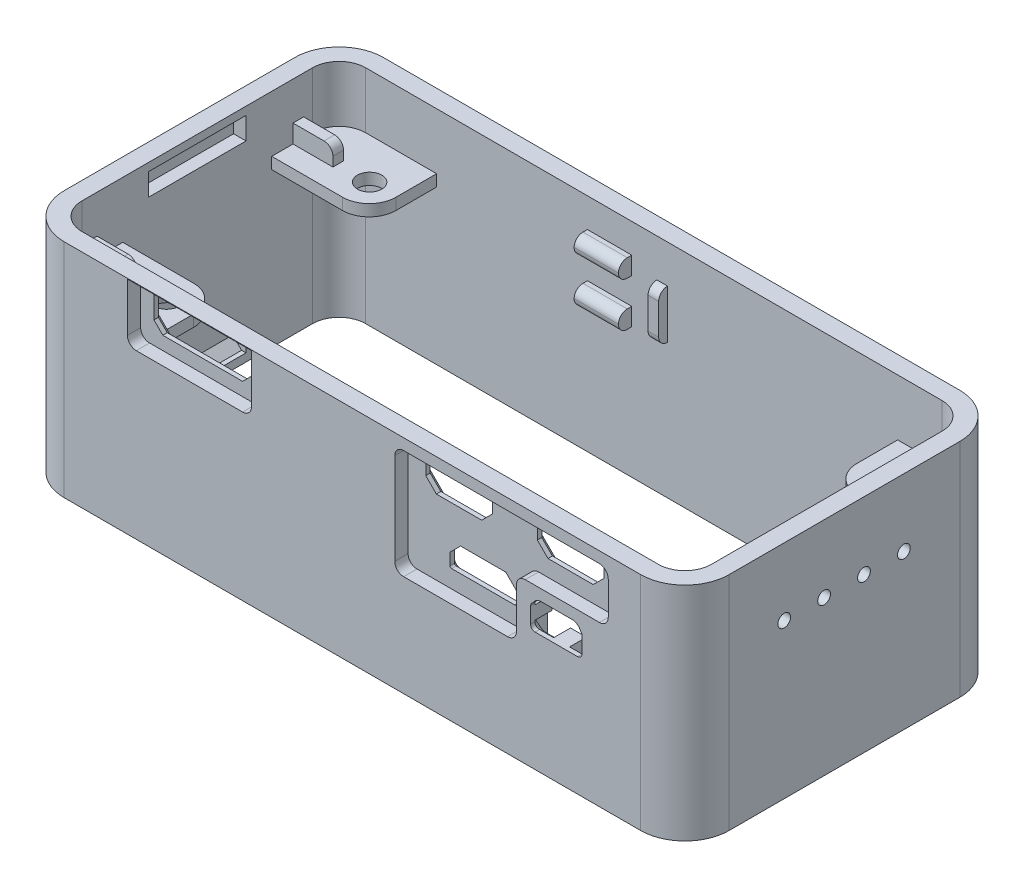
from build123d import *

# Parameters (mm, degrees)
EXTRUDE_1_DEPTH          = 7
EXTRUDE_1_DEPTH_BACK     = 18
CUT_EXTRUDE_2_DEPTH      = 47.607865253
CUT_EXTRUDE_2_DEPTH_BACK = 47.607865253
RIB_START                = -0.65
RIB_1_DEPTH              = 1.3
RIB_2_DEPTH              = 1.3
RIB_3_DEPTH              = 1.3
RIB_4_DEPTH              = 1.3
CUT_EXTRUDE_5_DEPTH      = 40
CUT_EXTRUDE_5_DEPTH_BACK = 40
SKETCH_18_R              = 1.375
SKETCH_41_W              = 14
SKETCH_41_H              = 6.5
CUT_EXTRUDE_14_DEPTH     = 1.5
EXTRUDE_14_DEPTH         = 0.5
CUT_EXTRUDE_18_DEPTH     = 1.5
SKETCH_50_W              = 7.5
SKETCH_50_H              = 2.7
CUT_EXTRUDE_19_DEPTH     = 2.9
SKETCH_51_W              = 5.8
SKETCH_51_H              = 2.8
CUT_EXTRUDE_20_DEPTH     = 2.4
FILLET_15_R              = 1
FILLET_16_R              = 1
FILLET_17_R              = 0.5
SKETCH_52_R              = 0.717792346
CUT_EXTRUDE_21_DEPTH     = 2
SKETCH_53_W              = 1.2
SKETCH_53_H              = 5.5
EXTRUDE_15_DEPTH         = 1
FILLET_20_R              = 1
SKETCH_55_W              = 1.2
SKETCH_55_H              = 5.5
EXTRUDE_17_DEPTH         = 1.4
SKETCH_54_W              = 1.2
SKETCH_54_H              = 5.5
EXTRUDE_18_DEPTH         = 4.5
FILLET_22_R              = 1
CHAMFER_2_SIZE           = 1.2
FILLET_23_R              = 0.2
SKETCH_58_W              = 11
SKETCH_58_H              = 2.5
CUT_EXTRUDE_23_DEPTH     = 1.4
CHAMFER_4_SIZE           = 1
SKETCH_59_W              = 11
SKETCH_59_H              = 2.5
CUT_EXTRUDE_24_DEPTH     = 1.4
CHAMFER_5_SIZE           = 1
SKETCH_60_W              = 7.5
SKETCH_60_H              = 5
CUT_EXTRUDE_25_DEPTH     = 0.5
EXTRUDE_20_DEPTH         = 0.9
EXTRUDE_20_DEPTH_BACK    = 0.5
SKETCH_56_W              = 0.6
SKETCH_56_H              = 1.5
SKETCH_56_W_2            = 1.8
SKETCH_56_H_2            = 0.767886541
SKETCH_56_W_3            = 1.5
SKETCH_56_H_3            = 1.54
CHAMFER_8_SIZE           = 1
SKETCH_63_W              = 1.2
SKETCH_63_H              = 5.5
EXTRUDE_21_DEPTH         = 4.5
FILLET_27_R              = 1
SKETCH_64_W              = 1.2
SKETCH_64_H              = 5.5
EXTRUDE_22_DEPTH         = 1.4
FILLET_28_R              = 1
SKETCH_65_W              = 1.2
SKETCH_65_H              = 5.5
EXTRUDE_23_DEPTH         = 0.9
CHAMFER_9_SIZE           = 0.5
FILLET_29_R              = 1
SKETCH_66_W              = 15
SKETCH_66_H              = 5
CUT_EXTRUDE_26_DEPTH     = 1.5
CHAMFER_10_SIZE          = 1
SKETCH_67_W              = 11
SKETCH_67_H              = 2.5
CUT_EXTRUDE_27_DEPTH     = 1.5
CHAMFER_11_SIZE          = 1
SKETCH_70_W              = 5
SKETCH_70_H              = 1.2
EXTRUDE_24_DEPTH         = 1.5
FILLET_31_R              = 1
SKETCH_71_W              = 5
SKETCH_71_H              = 2
EXTRUDE_25_DEPTH         = 1.5
FILLET_32_R              = 1
SKETCH_42_W              = 11
SKETCH_42_H              = 3.5
CUT_EXTRUDE_15_DEPTH     = 2.4
CUT_EXTRUDE_16_DEPTH     = 2.4
FILLET_33_R              = 1
SKETCH_74_W              = 16
SKETCH_74_H              = 7.4
EXTRUDE_26_DEPTH         = 0.5
CUT_EXTRUDE_29_REACH     = 58.074
SKETCH_46_W              = 11
SKETCH_46_H              = 3.5
CHAMFER_13_SIZE          = 1
FILLET_34_R              = 1
CHAMFER_14_SIZE          = 0.5
SKETCH_76_W              = 65
SKETCH_76_H              = 0.5
CUT_EXTRUDE_30_DEPTH     = 1.1
FILLET_35_R              = 1
FILLET_36_R              = 1.5


# Read off the part's stored shape, not the designer's step: 筋1, 筋2, 筋3, 筋4
# Some blends are built 0.0001 mm under size
with BuildPart() as part:
    # case 2 → 凸台-拉伸1 (new, two sides: drawn at the far end of the back side and taken through both)
    with BuildSketch(Plane(origin=(0, 0, 0), x_dir=(1, 0, 0), z_dir=(0, 1, 0)).offset(-EXTRUDE_1_DEPTH_BACK)):
        with BuildLine():
            Line((-34.042196447, 18), (30.957803553, 18))
            ThreePointArc((30.957803553, 18), (34.493337459, 16.535533906), (35.957803553, 13))
            Line((35.957803553, 13), (35.957803553, -13))
            ThreePointArc((35.957803553, -13), (34.493337459, -16.535533906), (30.957803553, -18))
            Line((30.957803553, -18), (-34.042196447, -18))
            ThreePointArc((-34.042196447, -18), (-37.577730353, -16.535533906), (-39.042196447, -13))
            Line((-39.042196447, -13), (-39.042196447, 13))
            ThreePointArc((-39.042196447, 13), (-37.577730353, 16.535533906), (-34.042196447, 18))
        make_face()
    extrude(amount=EXTRUDE_1_DEPTH + EXTRUDE_1_DEPTH_BACK)

    # 草图13 → 切除-拉伸2 (cut, two sides: drawn at the far end of the back side and taken through both)
    with BuildSketch(Plane(origin=(0, 0, 0), x_dir=(1, 0, 0), z_dir=(0, 1, 0)).offset(-CUT_EXTRUDE_2_DEPTH_BACK)):
        with BuildLine():
            Line((-34.042196447, -16), (30.957803553, -16))
            ThreePointArc((30.957803553, -16), (33.079123896, -15.121320344), (33.957803553, -13))
            Line((33.957803553, -13), (33.957803553, 13))
            ThreePointArc((33.957803553, 13), (33.079123896, 15.121320344), (30.957803553, 16))
            Line((30.957803553, 16), (-34.042196447, 16))
            ThreePointArc((-34.042196447, 16), (-36.163516791, 15.121320344), (-37.042196447, 13))
            Line((-37.042196447, 13), (-37.042196447, -13))
            ThreePointArc((-37.042196447, -13), (-36.163516791, -15.121320344), (-34.042196447, -16))
        make_face()
    extrude(amount=CUT_EXTRUDE_2_DEPTH + CUT_EXTRUDE_2_DEPTH_BACK, mode=Mode.SUBTRACT)

    # 筋1 outline → 筋1 (add)
    with BuildSketch(Plane(origin=(0, 0, 0), x_dir=(1, 0, 0), z_dir=(0, 1, 0)).offset(RIB_START)):
        with BuildLine():
            Line((-37.042196447, 8.4), (-29.042196447, 8.4))
            ThreePointArc((-29.042196447, 8.4), (-26.920876103, 9.278679657), (-26.042196447, 11.4))
            Line((-26.042196447, 11.4), (-26.042196447, 16))
            Line((-26.042196447, 16), (-34.042196447, 16))
            ThreePointArc((-34.042196447, 16), (-36.163516791, 15.121320344), (-37.042196447, 13))
            Line((-37.042196447, 13), (-37.042196447, 8.4))
        make_face()
    extrude(amount=RIB_1_DEPTH)

    # 筋2 outline → 筋2 (add)
    with BuildSketch(Plane(origin=(0, 0, 0), x_dir=(1, 0, 0), z_dir=(0, 1, 0)).offset(RIB_START)):
        with BuildLine():
            Line((-34.042196447, -16), (-26.042196447, -16))
            Line((-26.042196447, -16), (-26.042196447, -11.4))
            ThreePointArc((-26.042196447, -11.4), (-26.920876103, -9.278679657), (-29.042196447, -8.4))
            Line((-29.042196447, -8.4), (-37.042196447, -8.4))
            Line((-37.042196447, -8.4), (-37.042196447, -13))
            ThreePointArc((-37.042196447, -13), (-36.163516791, -15.121320344), (-34.042196447, -16))
        make_face()
    extrude(amount=RIB_2_DEPTH)

    # 筋3 outline → 筋3 (add)
    with BuildSketch(Plane(origin=(0, 0, 0), x_dir=(1, 0, 0), z_dir=(0, 1, 0)).offset(RIB_START)):
        with BuildLine():
            ThreePointArc((25.957803553, 11.4), (26.836483209, 9.278679656), (28.957803553, 8.4))
            Line((28.957803553, 8.4), (33.957803553, 8.4))
            Line((33.957803553, 8.4), (33.957803553, 13))
            ThreePointArc((33.957803553, 13), (33.079123897, 15.121320343), (30.957803553, 16))
            Line((30.957803553, 16), (25.957803553, 16))
            Line((25.957803553, 16), (25.957803553, 11.4))
        make_face()
    extrude(amount=RIB_3_DEPTH)

    # 筋4 outline → 筋4 (add)
    with BuildSketch(Plane(origin=(0, 0, 0), x_dir=(1, 0, 0), z_dir=(0, 1, 0)).offset(RIB_START)):
        with BuildLine():
            Line((33.957803553, -13), (33.957803553, -8.4))
            Line((33.957803553, -8.4), (28.957803553, -8.4))
            ThreePointArc((28.957803553, -8.4), (26.836483209, -9.278679656), (25.957803553, -11.4))
            Line((25.957803553, -11.4), (25.957803553, -16))
            Line((25.957803553, -16), (30.957803553, -16))
            ThreePointArc((30.957803553, -16), (33.079123897, -15.121320343), (33.957803553, -13))
        make_face()
    extrude(amount=RIB_4_DEPTH)

    # 草图18 → 切除-拉伸5 (cut, two sides: drawn at the far end of the back side and taken through both)
    with BuildSketch(Plane(origin=(0, 0, 0), x_dir=(1, 0, 0), z_dir=(0, 1, 0)).offset(-CUT_EXTRUDE_5_DEPTH_BACK)):
        with Locations(Location((-29, 11.4, 0), (0, 0, 270))):
            Circle(SKETCH_18_R)
        with Locations(Location((-29, -11.5, 0), (0, 0, 270))):
            Circle(SKETCH_18_R)
        with Locations(Location((29, 11.4, 0), (0, 0, 270))):
            Circle(SKETCH_18_R)
        with Locations(Location((29, -11.5, 0), (0, 0, 270))):
            Circle(SKETCH_18_R)
    extrude(amount=CUT_EXTRUDE_5_DEPTH + CUT_EXTRUDE_5_DEPTH_BACK, mode=Mode.SUBTRACT)

    # 草图41 → 切除-拉伸14 (cut)
    with BuildSketch(Plane.XY.offset(18)):
        with Locations((-19.922149827, 3.68)):
            Rectangle(SKETCH_41_W, SKETCH_41_H)
    extrude(amount=-CUT_EXTRUDE_14_DEPTH, mode=Mode.SUBTRACT)

    # 草图48 → 凸台-拉伸14 (add)
    with BuildSketch(Plane(origin=(0, 0, 16), x_dir=(-1, 0, 0), z_dir=(0, 0, -1))):
        Polygon((-2.234862183, -7.567886541), (-2.234862183, 6.748192542), (-28.313738428, 6.748192542), (-28.313738428, -1), (-17.957803553, -1), (-17.957803553, -7.567886541), align=None)
    extrude(amount=EXTRUDE_14_DEPTH)

    # 草图49 → 切除-拉伸18 (cut)
    with BuildSketch(Plane.XY.offset(18)):
        Polygon((27.313738428, 5.748192542), (27.313738428, 0), (16.957803553, 0), (16.957803553, -6.567886541), (3.234862183, -6.567886541), (3.234862183, 5.748192542), align=None)
    extrude(amount=-CUT_EXTRUDE_18_DEPTH, mode=Mode.SUBTRACT)

    # 草图50 → 切除-拉伸19 (cut)
    with BuildSketch(Plane.XY.offset(18)):
        with Locations((21.563738428, 3.198192542)):
            Rectangle(SKETCH_50_W, SKETCH_50_H)
        with Locations((11.707803553, -3.217886541)):
            Rectangle(SKETCH_50_W, SKETCH_50_H)
        with Locations((8.984862183, 3.198192542)):
            Rectangle(SKETCH_50_W, SKETCH_50_H)
    extrude(amount=-CUT_EXTRUDE_19_DEPTH, mode=Mode.SUBTRACT)

    # 草图51 → 切除-拉伸20 (cut)
    with BuildSketch(Plane.XY.offset(18)):
        with Locations((21.457803553, -3.167886541)):
            Rectangle(SKETCH_51_W, SKETCH_51_H)
    extrude(amount=-CUT_EXTRUDE_20_DEPTH, mode=Mode.SUBTRACT)

    # 圆角15
    fillet_15_edges = [part.edges().sort_by_distance(p)[0] for p in [
        (3.234862183, 5.748192542, 17.25),
        (27.313738428, 5.748192542, 17.25),
        (27.313738428, 0, 17.25),
        (16.957803553, 0, 17.25),
        (16.957803553, -6.567886541, 17.25),
        (3.234862183, -6.567886541, 17.25),
    ]]
    fillet(fillet_15_edges, radius=FILLET_15_R)

    # 圆角16
    # the kernel refuses this fillet: 1 mm, written as the material it takes off along each edge
    with BuildSketch(Plane(origin=(2.234862183, -7.567886541, 16), x_dir=(0, 1, 0), z_dir=(0, 0, -1)), Plane(origin=(17.957803553, -7.567886541, 16), x_dir=(-1, 0, 0), z_dir=(0, 0, -1))) as fillet_16_piece_1:
        with BuildLine():
            CenterArc((FILLET_16_R, FILLET_16_R), FILLET_16_R, 180, 90)
            Line((0, FILLET_16_R), (-FILLET_16_R * 0.02, FILLET_16_R))
            Line((-FILLET_16_R * 0.02, FILLET_16_R), (-FILLET_16_R * 0.02, -FILLET_16_R * 0.02))
            Line((-FILLET_16_R * 0.02, -FILLET_16_R * 0.02), (FILLET_16_R, -FILLET_16_R * 0.02))
            Line((FILLET_16_R, -FILLET_16_R * 0.02), (FILLET_16_R, 0))
        make_face()
    extrude(amount=3, mode=Mode.SUBTRACT)
    with BuildSketch(Plane(origin=(28.313738428, -1, 16), x_dir=(0, 1, 0), z_dir=(0, 0, -1))) as fillet_16_piece_2:
        with BuildLine():
            CenterArc((1, -0.759934208), FILLET_16_R, 130.541601874, 49.458398126)
            Line((0, -0.759934208), (-0.02, -0.759934208))
            Line((-0.02, -0.759934208), (-0.02, 0))
            Line((-0.02, 0), (0, 0.02))
            ThreePointArc((0, 0.02), (0.175, 0.02), (0.337, 0.015198684))
            Line((0.337, 0.015198684), (0.35, 0))
        make_face()
    extrude(amount=2.399835519, mode=Mode.SUBTRACT)

    # 圆角17
    fillet_17_edges = [part.edges().sort_by_distance(p)[0] for p in [
        (18.557803553, -1.767886541, 17),
        (24.357803553, -1.767886541, 17),
        (24.357803553, -4.567886541, 17),
        (18.557803553, -4.567886541, 17),
    ]]
    fillet(fillet_17_edges, radius=FILLET_17_R)

    # 草图52 → 切除-拉伸21 (cut)
    with BuildSketch(Plane(origin=(35.957803553, 0, 0), x_dir=(0, 0, -1), z_dir=(1, 0, 0))):
        with Locations((-6.8, -0.597891307)):
            Circle(SKETCH_52_R)
        with Locations((-2.3, -0.597891307)):
            Circle(SKETCH_52_R)
        with Locations((2.2, -0.597891307)):
            Circle(SKETCH_52_R)
        with Locations((6.7, -0.597891307)):
            Circle(SKETCH_52_R)
    extrude(amount=-CUT_EXTRUDE_21_DEPTH, mode=Mode.SUBTRACT)

    # 草图53 → 凸台-拉伸15 (add)
    with BuildSketch(Plane.XY.offset(-16)):
        with Locations((-0.6, -0.05)):
            Rectangle(SKETCH_53_W, SKETCH_53_H)
    extrude(amount=EXTRUDE_15_DEPTH)

    # 圆角20
    fillet_20_edges = [part.edges().sort_by_distance(p)[0] for p in [
        (-0.6, -2.8, -15),
        (-0.6, 2.7, -15),
    ]]
    fillet(fillet_20_edges, radius=FILLET_20_R - 0.0001)  # a hair under: the kernel refuses the full size

    # 草图55 → 凸台-拉伸17 (add)
    with BuildSketch(Plane.ZY.offset(-33.957803553)):
        with Locations((-11.4, -0.05)):
            Rectangle(SKETCH_55_W, SKETCH_55_H)
    extrude(amount=EXTRUDE_17_DEPTH)

    # 草图54 → 凸台-拉伸18 (add)
    with BuildSketch(Plane(origin=(-37.042196447, 0, 0), x_dir=(0, 0, -1), z_dir=(1, 0, 0))):
        with Locations((11.4, -0.05)):
            Rectangle(SKETCH_54_W, SKETCH_54_H)
    extrude(amount=EXTRUDE_18_DEPTH)

    # 圆角22
    fillet_22_edges = [part.edges().sort_by_distance(p)[0] for p in [
        (32.557803553, -2.8, -11.4),
        (32.557803553, 2.7, -11.4),
        (-32.542196447, -2.8, -11.4),
        (-32.542196447, 2.7, -11.4),
    ]]
    fillet(fillet_22_edges, radius=FILLET_22_R)

    # 倒角2
    chamfer_2_edges = [part.edges().sort_by_distance(p)[0] for p in [
        (25.313738428, 1.848192542, 16),
        (17.813738428, 1.848192542, 16),
        (7.957803553, -1.867886541, 16),
        (15.457803553, -1.867886541, 16),
        (5.234862183, 1.848192542, 16),
        (12.734862183, 1.848192542, 16),
    ]]
    chamfer(chamfer_2_edges, length=CHAMFER_2_SIZE)

    # 圆角23
    fillet_23_edges = [part.edges().sort_by_distance(p)[0] for p in [
        (17.813738428, 4.548192542, 16),
        (25.313738428, 4.548192542, 16),
        (15.457803553, -4.567886541, 16),
        (7.957803553, -4.567886541, 16),
        (5.234862183, 4.548192542, 16),
        (12.734862183, 4.548192542, 16),
    ]]
    fillet(fillet_23_edges, radius=FILLET_23_R)

    # 草图58 → 切除-拉伸23 (cut)
    with BuildSketch(Plane.ZY.offset(-33.957803553)):
        with Locations((0, -15.85)):
            Rectangle(SKETCH_58_W, SKETCH_58_H)
    extrude(amount=-CUT_EXTRUDE_23_DEPTH, mode=Mode.SUBTRACT)

    # 倒角4
    chamfer_4_edges = [part.edges().sort_by_distance(p)[0] for p in [
        (35.357803553, -17.1, 0),
    ]]
    chamfer(chamfer_4_edges, length=CHAMFER_4_SIZE)

    # 草图59 → 切除-拉伸24 (cut)
    with BuildSketch(Plane(origin=(-37.042196447, 0, 0), x_dir=(0, 0, -1), z_dir=(1, 0, 0))):
        with Locations((0, 4.85)):
            Rectangle(SKETCH_59_W, SKETCH_59_H)
    extrude(amount=-CUT_EXTRUDE_24_DEPTH, mode=Mode.SUBTRACT)

    # 倒角5
    chamfer_5_edges = [part.edges().sort_by_distance(p)[0] for p in [
        (-38.442196447, 6.1, 0),
    ]]
    chamfer(chamfer_5_edges, length=CHAMFER_5_SIZE)

    # 草图60 → 切除-拉伸25 (cut)
    with BuildSketch(Plane(origin=(0, 0, 16), x_dir=(-1, 0, 0), z_dir=(0, 0, -1))):
        with Locations((-21.707803553, -3.5)):
            Rectangle(SKETCH_60_W, SKETCH_60_H)
    extrude(amount=-CUT_EXTRUDE_25_DEPTH, mode=Mode.SUBTRACT)

    # 草图56 → 凸台-拉伸20 (add, two sides: drawn at the far end of the back side and taken through both)
    with BuildSketch(Plane(origin=(0, 0, 16), x_dir=(-1, 0, 0), z_dir=(0, 0, -1)).offset(-EXTRUDE_20_DEPTH_BACK)):
        with Locations((-18.257803553, -3.15173139)):
            Rectangle(SKETCH_56_W, SKETCH_56_H)
        with Locations((-21.557803553, -1.383943271)):
            Rectangle(SKETCH_56_W_2, SKETCH_56_H_2)
        with Locations((-25.107803553, -3.15173139)):
            Rectangle(SKETCH_56_W_3, SKETCH_56_H)
        with Locations((-21.557803553, -5.337886541)):
            Rectangle(SKETCH_56_W_2, SKETCH_56_H_3)
    extrude(amount=EXTRUDE_20_DEPTH + EXTRUDE_20_DEPTH_BACK)

    # 倒角8
    # the kernel refuses this chamfer: 1 mm, written as the material it takes off along each edge
    with BuildSketch(Plane(origin=(19.057803553, -2.267886541, 16.5), x_dir=(-1, 0, 0), z_dir=(0, -1, 0))) as chamfer_8_piece_1_section:
        Polygon((0.5, -CHAMFER_8_SIZE), (0.5 + CHAMFER_8_SIZE, 0), (0.5, 0), align=None)
    chamfer_8_piece_1 = revolve(axis=Axis((19.057803553, -2.267886541, 16.5), (0, 0, -1)), revolution_arc=90, mode=Mode.PRIVATE)
    chamfer_8_piece_1 = split(chamfer_8_piece_1, bisect_by=Plane(origin=(17.957803553, -1.691525434, 16.812800838), z_dir=(1, 0, 0)), keep=Keep.TOP, mode=Mode.PRIVATE)
    chamfer_8_piece_1 = split(chamfer_8_piece_1, bisect_by=Plane(origin=(18.527910829, -1, 16.812800838), z_dir=(0, -1, 0)), keep=Keep.TOP, mode=Mode.PRIVATE)
    add(chamfer_8_piece_1, mode=Mode.SUBTRACT)
    with BuildSketch(Plane(origin=(24.357803553, -2.267886541, 16.5), x_dir=(-0.027495876610585647, 0, 0.9996219169112968), z_dir=(0, -1, 0))) as chamfer_8_piece_2:
        Polygon((CHAMFER_8_SIZE * 0.999621916911, -CHAMFER_8_SIZE * 0.0274958766106), (-CHAMFER_8_SIZE * 0.0274958766106, -CHAMFER_8_SIZE * 0.999621916911), (0, 0), align=None)
    extrude(amount=0.133844849, mode=Mode.SUBTRACT)
    with BuildSketch(Plane(origin=(23.857803553, -4.067886541, 16.5), x_dir=(1, 0, 0), z_dir=(0, 1, 0))) as chamfer_8_piece_3:
        Polygon((0.5, -CHAMFER_8_SIZE), (0.5 + CHAMFER_8_SIZE, 0), (0.5, 0), align=None)
    revolve(axis=Axis((23.857803553, -4.067886541, 16.5), (0, 0, -1)), revolution_arc=90, mode=Mode.SUBTRACT)
    with BuildSketch(Plane(origin=(23.857803553, -4.567886541, 16.5), x_dir=(0, 0.02749587661058651, 0.9996219169112968), z_dir=(-1, 0, 0))) as chamfer_8_piece_4:
        Polygon((CHAMFER_8_SIZE * 0.999621916911, -CHAMFER_8_SIZE * 0.0274958766106), (-CHAMFER_8_SIZE * 0.0274958766106, -CHAMFER_8_SIZE * 0.999621916911), (0, 0), align=None)
    extrude(amount=1.4, mode=Mode.SUBTRACT)
    with BuildSketch(Plane(origin=(23.857803553, -4.567886541, 16.5), x_dir=(0, 0.02749587661058651, 0.9996219169112968), z_dir=(-1, 0, 0))) as chamfer_8_piece_5_section:
        Polygon((CHAMFER_8_SIZE * 0.999621916911, -CHAMFER_8_SIZE * 0.0274958766106), (-CHAMFER_8_SIZE * 0.0274958766106, -CHAMFER_8_SIZE * 0.999621916911), (0, 0), align=None)
    chamfer_8_piece_5 = extrude(amount=3.971682988, mode=Mode.PRIVATE)
    chamfer_8_piece_5 = split(chamfer_8_piece_5, bisect_by=Plane(origin=(20.657803553, -4.897680168, 16.829793627), z_dir=(-1, 0, 0)), keep=Keep.TOP, mode=Mode.PRIVATE)
    add(chamfer_8_piece_5, mode=Mode.SUBTRACT)
    with BuildSketch(Plane(origin=(19.057803553, -4.067886541, 16.5), x_dir=(0, -1, 0), z_dir=(1, 0, 0))) as chamfer_8_piece_6_section:
        Polygon((0.5, -CHAMFER_8_SIZE), (0.5 + CHAMFER_8_SIZE, 0), (0.5, 0), align=None)
    chamfer_8_piece_6 = revolve(axis=Axis((19.057803553, -4.067886541, 16.5), (0, 0, -1)), revolution_arc=90, mode=Mode.PRIVATE)
    chamfer_8_piece_6 = split(chamfer_8_piece_6, bisect_by=Plane(origin=(17.957803553, -4.664386094, 16.805594695), z_dir=(1, 0, 0)), keep=Keep.TOP, mode=Mode.PRIVATE)
    add(chamfer_8_piece_6, mode=Mode.SUBTRACT)
    with BuildSketch(Plane(origin=(18.557803553, -4.067886541, 16.5), x_dir=(0.027495876610585647, 0, 0.9996219169112968), z_dir=(0, 1, 0))) as chamfer_8_piece_7_section:
        Polygon((CHAMFER_8_SIZE * 0.999621916911, -CHAMFER_8_SIZE * 0.0274958766106), (-CHAMFER_8_SIZE * 0.0274958766106, -CHAMFER_8_SIZE * 0.999621916911), (0, 0), align=None)
    chamfer_8_piece_7 = extrude(amount=0.166155151, mode=Mode.PRIVATE)
    chamfer_8_piece_7 = split(chamfer_8_piece_7, bisect_by=Plane(origin=(17.957803553, -3.984808965, 16.87500946), z_dir=(1, 0, 0)), keep=Keep.TOP, mode=Mode.PRIVATE)
    add(chamfer_8_piece_7, mode=Mode.SUBTRACT)
    with BuildSketch(Plane(origin=(19.057803553, -1.767886541, 16.5), x_dir=(0, -0.02749587661058651, 0.9996219169112968), z_dir=(1, 0, 0))) as chamfer_8_piece_8_section:
        Polygon((CHAMFER_8_SIZE * 0.999621916911, -CHAMFER_8_SIZE * 0.0274958766106), (-CHAMFER_8_SIZE * 0.0274958766106, -CHAMFER_8_SIZE * 0.999621916911), (0, 0), align=None)
    chamfer_8_piece_8 = extrude(amount=1.6, mode=Mode.PRIVATE)
    chamfer_8_piece_8 = split(chamfer_8_piece_8, bisect_by=Plane(origin=(19.857803553, -1, 16.849634221), z_dir=(0, -1, 0)), keep=Keep.TOP, mode=Mode.PRIVATE)
    add(chamfer_8_piece_8, mode=Mode.SUBTRACT)
    with BuildSketch(Plane(origin=(19.057803553, -1.767886541, 16.5), x_dir=(0, -0.02749587661058651, 0.9996219169112968), z_dir=(1, 0, 0))) as chamfer_8_piece_9_section:
        Polygon((CHAMFER_8_SIZE * 0.999621916911, -CHAMFER_8_SIZE * 0.0274958766106), (-CHAMFER_8_SIZE * 0.0274958766106, -CHAMFER_8_SIZE * 0.999621916911), (0, 0), align=None)
    chamfer_8_piece_9 = extrude(amount=4.171682988, mode=Mode.PRIVATE)
    chamfer_8_piece_9 = split(chamfer_8_piece_9, bisect_by=Plane(origin=(22.843645047, -1, 16.849634221), z_dir=(0, -1, 0)), keep=Keep.TOP, mode=Mode.PRIVATE)
    chamfer_8_piece_9 = split(chamfer_8_piece_9, bisect_by=Plane(origin=(22.457803553, -1.47595166, 16.849634221), z_dir=(1, 0, 0)), keep=Keep.TOP, mode=Mode.PRIVATE)
    add(chamfer_8_piece_9, mode=Mode.SUBTRACT)
    with BuildSketch(Plane(origin=(23.857803553, -2.267886541, 16.5), x_dir=(0, 1, 0), z_dir=(-1, 0, 0))) as chamfer_8_piece_10_section:
        Polygon((0.5, -CHAMFER_8_SIZE), (0.5 + CHAMFER_8_SIZE, 0), (0.5, 0), align=None)
    chamfer_8_piece_10 = revolve(axis=Axis((23.857803553, -2.267886541, 16.5), (0, 0, -1)), revolution_arc=90, mode=Mode.PRIVATE)
    chamfer_8_piece_10 = split(chamfer_8_piece_10, bisect_by=Plane(origin=(24.442211252, -1, 16.795113349), z_dir=(0, -1, 0)), keep=Keep.TOP, mode=Mode.PRIVATE)
    add(chamfer_8_piece_10, mode=Mode.SUBTRACT)
    with BuildSketch(Plane(origin=(19.886120565, -1.767886541, 16.5), x_dir=(0, -0.027495876610586296, 0.9996219169112968), z_dir=(1, 0, 0))) as chamfer_8_piece_11_section:
        Polygon((CHAMFER_8_SIZE * 0.999621916911, -CHAMFER_8_SIZE * 0.0274958766106), (-CHAMFER_8_SIZE * 0.0274958766106, -CHAMFER_8_SIZE * 0.999621916911), (0, 0), align=None)
    chamfer_8_piece_11 = extrude(amount=3.971682988, mode=Mode.PRIVATE)
    chamfer_8_piece_11 = split(chamfer_8_piece_11, bisect_by=Plane(origin=(20.271962059, -1, 16.849634221), z_dir=(0, -1, 0)), keep=Keep.TOP, mode=Mode.PRIVATE)
    chamfer_8_piece_11 = split(chamfer_8_piece_11, bisect_by=Plane(origin=(20.657803553, -1.47595166, 16.849634221), z_dir=(-1, 0, 0)), keep=Keep.TOP, mode=Mode.PRIVATE)
    add(chamfer_8_piece_11, mode=Mode.SUBTRACT)
    with BuildSketch(Plane(origin=(22.457803553, -1.767886541, 16.5), x_dir=(0, -0.02749587661058651, 0.9996219169112968), z_dir=(1, 0, 0))) as chamfer_8_piece_12_section:
        Polygon((CHAMFER_8_SIZE * 0.999621916911, -CHAMFER_8_SIZE * 0.0274958766106), (-CHAMFER_8_SIZE * 0.0274958766106, -CHAMFER_8_SIZE * 0.999621916911), (0, 0), align=None)
    chamfer_8_piece_12 = extrude(amount=1.4, mode=Mode.PRIVATE)
    chamfer_8_piece_12 = split(chamfer_8_piece_12, bisect_by=Plane(origin=(23.157803553, -1, 16.849634221), z_dir=(0, -1, 0)), keep=Keep.TOP, mode=Mode.PRIVATE)
    add(chamfer_8_piece_12, mode=Mode.SUBTRACT)
    with BuildSketch(Plane(origin=(18.557803553, -2.40173139, 16.5), x_dir=(0.027495876610585647, 0, 0.9996219169112968), z_dir=(0, 1, 0))) as chamfer_8_piece_13_section:
        Polygon((CHAMFER_8_SIZE * 0.999621916911, -CHAMFER_8_SIZE * 0.0274958766106), (-CHAMFER_8_SIZE * 0.0274958766106, -CHAMFER_8_SIZE * 0.999621916911), (0, 0), align=None)
    chamfer_8_piece_13 = extrude(amount=0.133844849, mode=Mode.PRIVATE)
    chamfer_8_piece_13 = split(chamfer_8_piece_13, bisect_by=Plane(origin=(17.957803553, -2.334808965, 16.87500946), z_dir=(1, 0, 0)), keep=Keep.TOP, mode=Mode.PRIVATE)
    add(chamfer_8_piece_13, mode=Mode.SUBTRACT)
    with BuildSketch(Plane(origin=(24.357803553, -3.90173139, 16.5), x_dir=(-0.027495876610585647, 0, 0.9996219169112968), z_dir=(0, -1, 0))) as chamfer_8_piece_14:
        Polygon((CHAMFER_8_SIZE * 0.999621916911, -CHAMFER_8_SIZE * 0.0274958766106), (-CHAMFER_8_SIZE * 0.0274958766106, -CHAMFER_8_SIZE * 0.999621916911), (0, 0), align=None)
    extrude(amount=0.166155151, mode=Mode.SUBTRACT)
    with BuildSketch(Plane(origin=(23.229486541, -4.567886541, 16.5), x_dir=(0, 0.02749587661058651, 0.9996219169112968), z_dir=(-1, 0, 0))) as chamfer_8_piece_15_section:
        Polygon((CHAMFER_8_SIZE * 0.999621916911, -CHAMFER_8_SIZE * 0.0274958766106), (-CHAMFER_8_SIZE * 0.0274958766106, -CHAMFER_8_SIZE * 0.999621916911), (0, 0), align=None)
    chamfer_8_piece_15 = extrude(amount=4.171682988, mode=Mode.PRIVATE)
    chamfer_8_piece_15 = split(chamfer_8_piece_15, bisect_by=Plane(origin=(22.457803553, -4.897680168, 16.829793627), z_dir=(1, 0, 0)), keep=Keep.TOP, mode=Mode.PRIVATE)
    add(chamfer_8_piece_15, mode=Mode.SUBTRACT)
    with BuildSketch(Plane(origin=(20.657803553, -4.567886541, 16.5), x_dir=(0, 0.02749587661058651, 0.9996219169112968), z_dir=(-1, 0, 0))) as chamfer_8_piece_16:
        Polygon((CHAMFER_8_SIZE * 0.999621916911, -CHAMFER_8_SIZE * 0.0274958766106), (-CHAMFER_8_SIZE * 0.0274958766106, -CHAMFER_8_SIZE * 0.999621916911), (0, 0), align=None)
    extrude(amount=1.6, mode=Mode.SUBTRACT)

    # 草图63 → 凸台-拉伸21 (add)
    with BuildSketch(Plane(origin=(-37.042196447, 0, 0), x_dir=(0, 0, -1), z_dir=(1, 0, 0))):
        with Locations((-11.9, -0.05)):
            Rectangle(SKETCH_63_W, SKETCH_63_H)
    extrude(amount=EXTRUDE_21_DEPTH)

    # 圆角27
    fillet_27_edges = [part.edges().sort_by_distance(p)[0] for p in [
        (-32.542196447, -2.8, 11.9),
        (-32.542196447, 2.7, 11.9),
    ]]
    fillet(fillet_27_edges, radius=FILLET_27_R)

    # 草图64 → 凸台-拉伸22 (add)
    with BuildSketch(Plane.ZY.offset(-33.957803553)):
        with Locations((11.9, -0.05)):
            Rectangle(SKETCH_64_W, SKETCH_64_H)
    extrude(amount=EXTRUDE_22_DEPTH)

    # 圆角28
    fillet_28_edges = [part.edges().sort_by_distance(p)[0] for p in [
        (32.557803553, -2.8, 11.9),
        (32.557803553, 2.7, 11.9),
    ]]
    fillet(fillet_28_edges, radius=FILLET_28_R)

    # 草图65 → 凸台-拉伸23 (add)
    with BuildSketch(Plane(origin=(0, 0, 16), x_dir=(-1, 0, 0), z_dir=(0, 0, -1))):
        with Locations((0.6, -0.05)):
            Rectangle(SKETCH_65_W, SKETCH_65_H)
    extrude(amount=EXTRUDE_23_DEPTH)

    # 倒角9
    chamfer_9_edges = [part.edges().sort_by_distance(p)[0] for p in [
        (21.557803553, -1.767886541, 15.1),
        (18.557803553, -3.15173139, 15.1),
        (24.357803553, -3.15173139, 15.1),
        (21.557803553, -4.567886541, 15.1),
    ]]
    chamfer(chamfer_9_edges, length=CHAMFER_9_SIZE)

    # 圆角29
    # the kernel refuses this fillet: 1 mm, written as the material it takes off along each edge
    with BuildSketch(Plane(origin=(0, -2.8, 15.1), x_dir=(0, 0, 1), z_dir=(-1, 0, 0)), Plane(origin=(-3.687468593, 2.7, 15.1), x_dir=(0, 0, 1), z_dir=(1, 0, 0))) as fillet_29_piece_1:
        with BuildLine():
            CenterArc((1, 0.994987437), FILLET_29_R, 180, 84.260829523)
            Line((0, 0.994987437), (0, 0))
            Line((0, 0), (0.9, 0))
        make_face()
    extrude(amount=3.687468593, mode=Mode.SUBTRACT)

    # 草图66 → 切除-拉伸26 (cut)
    with BuildSketch(Plane.ZY.offset(-33.957803553)):
        with Locations((0, 3.6)):
            Rectangle(SKETCH_66_W, SKETCH_66_H)
    extrude(amount=-CUT_EXTRUDE_26_DEPTH, mode=Mode.SUBTRACT)

    # 倒角10
    chamfer_10_edges = [part.edges().sort_by_distance(p)[0] for p in [
        (35.457803553, 6.1, 0),
    ]]
    chamfer(chamfer_10_edges, length=CHAMFER_10_SIZE)

    # 草图67 → 切除-拉伸27 (cut)
    with BuildSketch(Plane(origin=(-37.042196447, 0, 0), x_dir=(0, 0, -1), z_dir=(1, 0, 0))):
        with Locations((0, -15.85)):
            Rectangle(SKETCH_67_W, SKETCH_67_H)
    extrude(amount=-CUT_EXTRUDE_27_DEPTH, mode=Mode.SUBTRACT)

    # 倒角11
    chamfer_11_edges = [part.edges().sort_by_distance(p)[0] for p in [
        (-38.542196447, -17.1, 0),
    ]]
    chamfer(chamfer_11_edges, length=CHAMFER_11_SIZE)

    # 草图70 → 凸台-拉伸24 (add)
    with BuildSketch(Plane(origin=(0, 0, 16), x_dir=(-1, 0, 0), z_dir=(0, 0, -1))):
        with Locations((6.542196447, 2.45)):
            Rectangle(SKETCH_70_W, SKETCH_70_H)
        with Locations((6.542196447, -2.45)):
            Rectangle(SKETCH_70_W, SKETCH_70_H)
    extrude(amount=EXTRUDE_24_DEPTH)

    # 圆角31
    fillet_31_edges = [part.edges().sort_by_distance(p)[0] for p in [
        (-6.542196447, 3.05, 14.5),
        (-6.542196447, -3.05, 14.5),
    ]]
    fillet(fillet_31_edges, radius=FILLET_31_R)

    # 草图71 → 凸台-拉伸25 (add)
    with BuildSketch(Plane.XY.offset(-16)):
        with Locations((-6.537335394, 2.7)):
            Rectangle(SKETCH_71_W, SKETCH_71_H)
        with Locations((-6.537335394, -2.3)):
            Rectangle(SKETCH_71_W, SKETCH_71_H)
    extrude(amount=EXTRUDE_25_DEPTH)

    # 圆角32
    fillet_32_edges = [part.edges().sort_by_distance(p)[0] for p in [
        (-6.537335394, -3.3, -14.5),
        (-6.537335394, -1.3, -14.5),
        (-6.537335394, 1.7, -14.5),
        (-6.537335394, 3.7, -14.5),
    ]]
    fillet(fillet_32_edges, radius=FILLET_32_R - 0.0001)  # a hair under: the kernel refuses the full size

    # 草图42 → 切除-拉伸15 (cut)
    with BuildSketch(Plane.XY.offset(18)):
        with Locations((-19.922149827, 3.68)):
            Rectangle(SKETCH_42_W, SKETCH_42_H)
    extrude(amount=-CUT_EXTRUDE_15_DEPTH, mode=Mode.SUBTRACT)

    # 草图45 → 切除-拉伸16 (cut)
    with BuildSketch(Plane.XY.offset(18)):
        with BuildLine():
            Line((23.25, -1.252356616), (19.75, -1.252356616))
            ThreePointArc((19.75, -1.252356616), (19.042893219, -1.545249835), (18.75, -2.252356616))
            Line((18.75, -2.252356616), (18.75, -3.452356616))
            ThreePointArc((18.75, -3.452356616), (19.042893219, -4.159463397), (19.75, -4.452356616))
            Line((19.75, -4.452356616), (23.25, -4.452356616))
            ThreePointArc((23.25, -4.452356616), (23.957106781, -4.159463397), (24.25, -3.452356616))
            Line((24.25, -3.452356616), (24.25, -2.252356616))
            ThreePointArc((24.25, -2.252356616), (23.957106781, -1.545249835), (23.25, -1.252356616))
        make_face()
    extrude(amount=-CUT_EXTRUDE_16_DEPTH, mode=Mode.SUBTRACT)

    # 圆角33
    fillet_33_edges = [part.edges().sort_by_distance(p)[0] for p in [
        (-26.922149827, 0.43, 17.25),
        (-12.922149827, 0.43, 17.25),
    ]]
    fillet(fillet_33_edges, radius=FILLET_33_R)

    # 草图74 → 凸台-拉伸26 (add)
    with BuildSketch(Plane(origin=(0, 0, 16), x_dir=(-1, 0, 0), z_dir=(0, 0, -1))):
        with Locations((20.042196447, 3.3)):
            Rectangle(SKETCH_74_W, SKETCH_74_H)
    extrude(amount=EXTRUDE_26_DEPTH)

    # 草图46 → 切除-拉伸29 (cut, up to next)
    with BuildSketch(Plane.XY.offset(18), mode=Mode.PRIVATE) as cut_extrude_29_sk1:
        with Locations((-19.922149827, 3.68)):
            Rectangle(SKETCH_46_W, SKETCH_46_H)
    cut_extrude_29_tool1 = extrude(cut_extrude_29_sk1.sketch, amount=-CUT_EXTRUDE_29_REACH, mode=Mode.PRIVATE) & part.part
    add(cut_extrude_29_tool1.solids().sort_by_distance((-19.92215, 3.68, 18))[0], mode=Mode.SUBTRACT)

    # 倒角13
    chamfer_13_edges = [part.edges().sort_by_distance(p)[0] for p in [
        (-25.422149827, 1.93, 16),
        (-14.422149827, 1.93, 16),
    ]]
    chamfer(chamfer_13_edges, length=CHAMFER_13_SIZE)

    # 圆角34
    fillet_34_edges = [part.edges().sort_by_distance(p)[0] for p in [
        (-12.042196447, -0.4, 15.75),
    ]]
    fillet(fillet_34_edges, radius=FILLET_34_R)

    # 倒角14
    chamfer_14_edges = [part.edges().sort_by_distance(p)[0] for p in [
        (-19.922149827, 5.43, 15.5),
        (-25.422149827, 4.18, 15.5),
        (-14.422149827, 4.18, 15.5),
        (-19.922149827, 1.93, 15.5),
        (-14.922149827, 2.43, 15.5),
        (-24.922149827, 2.43, 15.5),
        (11.707803553, -1.867886541, 15.5),
        (15.457803553, -3.717886541, 15.5),
        (8.984862183, 1.848192542, 15.5),
        (5.234862183, 3.698192542, 15.5),
        (21.563738428, 1.848192542, 15.5),
        (17.813738428, 3.698192542, 15.5),
        (14.857803553, -2.467886541, 15.5),
        (8.557803553, -2.467886541, 15.5),
        (5.834862183, 2.448192542, 15.5),
        (12.134862183, 2.448192542, 15.5),
        (24.713738428, 2.448192542, 15.5),
        (18.413738428, 2.448192542, 15.5),
        (8.984862183, 4.548192542, 15.5),
        (12.734862183, 3.698192542, 15.5),
        (21.563738428, 4.548192542, 15.5),
        (25.313738428, 3.698192542, 15.5),
        (11.707803553, -4.567886541, 15.5),
        (7.957803553, -3.717886541, 15.5),
        (5.293440827, 4.489613898, 15.5),
        (12.676283539, 4.489613898, 15.5),
        (17.872317072, 4.489613898, 15.5),
        (25.255159784, 4.489613898, 15.5),
        (15.399224909, -4.509307897, 15.5),
        (8.016382197, -4.509307897, 15.5),
    ]]
    chamfer(chamfer_14_edges, length=CHAMFER_14_SIZE)

    # 草图76 → 切除-拉伸30 (cut)
    with BuildSketch(Plane(origin=(0, 7, 0), x_dir=(1, 0, 0), z_dir=(0, 1, 0))):
        with Locations((-1.542196447, -15.75)):
            Rectangle(SKETCH_76_W, SKETCH_76_H)
    extrude(amount=-CUT_EXTRUDE_30_DEPTH, mode=Mode.SUBTRACT)

    # 圆角35
    fillet_35_edges = [part.edges().sort_by_distance(p)[0] for p in [
        (2.234862183, 5.9, 15.75),
        (28.313738428, 5.9, 15.75),
        (-12.042196447, 5.9, 15.75),
        (-28.042196447, 5.9, 15.75),
    ]]
    fillet(fillet_35_edges, radius=FILLET_35_R)

    # 圆角36
    fillet_36_edges = [part.edges().sort_by_distance(p)[0] for p in [
        (35.457803553, 3.1, 7.5),
        (35.457803553, 1.1, 0),
        (35.457803553, 3.1, -7.5),
    ]]
    fillet(fillet_36_edges, radius=FILLET_36_R - 0.0001)  # a hair under: the kernel refuses the full size


solid = part.part
